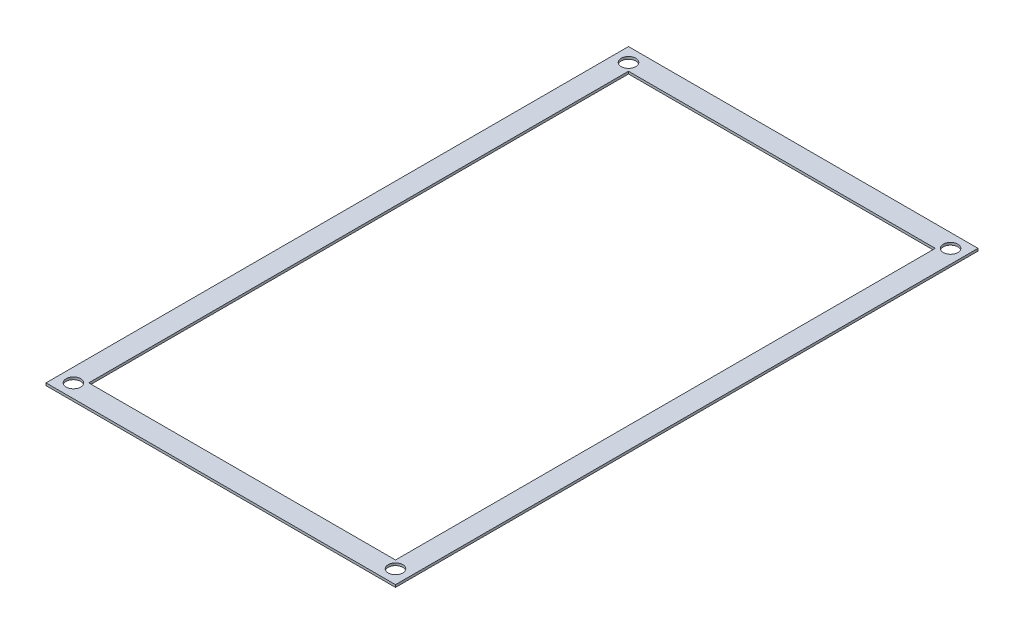
from build123d import *

# Parameters (mm, degrees)
SKETCH3_R           = 0.75
BOSS_EXTRUDE1_DEPTH = 0.25
SKETCH4_W           = 31.6
SKETCH4_H           = 55.6
CUT_EXTRUDE1_DEPTH  = 10


with BuildPart() as part:
    # Sketch3 → Boss-Extrude1 (new body)
    with BuildSketch(Plane(origin=(0, 0, 0), x_dir=(1, 0, 0), z_dir=(0, 1, 0))):
        Polygon((-18, 35.809268437), (-18, 26), (-18, -14.381463126), (-18, -24.190731563), (-8.190731563, -24.190731563), (8.190731563, -24.190731563), (18, -24.190731563), (18, -14.381463126), (18, 26), (18, 35.809268437), (8.190731563, 35.809268437), (-8.190731563, 35.809268437), align=None)
        with Locations((-16.585786438, -22.776518001)):
            Circle(SKETCH3_R, mode=Mode.SUBTRACT)
        with Locations((16.585786438, -22.776518001)):
            Circle(SKETCH3_R, mode=Mode.SUBTRACT)
        with Locations((-16.585786438, 34.395054875)):
            Circle(SKETCH3_R, mode=Mode.SUBTRACT)
        with Locations((16.585786438, 34.395054875)):
            Circle(SKETCH3_R, mode=Mode.SUBTRACT)
    extrude(amount=BOSS_EXTRUDE1_DEPTH)

    # Sketch4 → Cut-Extrude1 (cut)
    with BuildSketch(Plane(origin=(0, 0.25, 0), x_dir=(1, 0, 0), z_dir=(0, 1, 0))):
        with Locations((0, 5.809268437)):
            Rectangle(SKETCH4_W, SKETCH4_H)
    extrude(amount=-CUT_EXTRUDE1_DEPTH, mode=Mode.SUBTRACT)


solid = part.part
